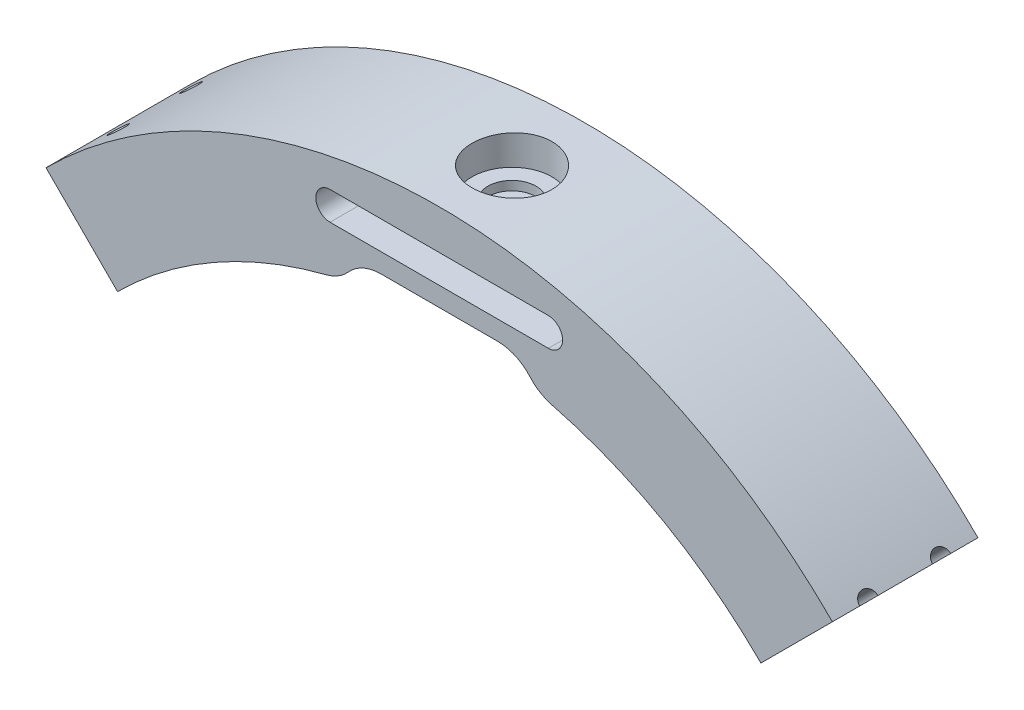
from build123d import *

# Parameters (mm, degrees)
SKETCH1_R                    = 76.4
BOSS_EXTRUDE1_DEPTH          = 20
CUT_EXTRUDE1_REACH           = 111.881
SKETCH2_R                    = 62.5
CUT_EXTRUDE2_DEPTH           = 110.881390599
CIRPATTERN1_COUNT            = 4
R_P_TITION_CIRCULAIRE2_COUNT = 4
CUT_EXTRUDE4_START           = -20
CUT_EXTRUDE4_DEPTH           = 130.881390756
CIRPATTERN8_COUNT            = 4
CIRPATTERN8_START            = -20
CIRPATTERN8_COPY_1_DEPTH     = 130.881390756
CIRPATTERN8_COPY_2_DEPTH     = 130.881390756
CIRPATTERN8_COPY_3_DEPTH     = 130.881390756
SPLIT1_SURFACE_1_BACK        = 218.015
SPLIT1_SURFACE_1_DEPTH       = 436.03


# Read off the part's stored shape, not the designer's step: Répétition circulaire1, Répétition linéaire1
with BuildPart() as part:
    # Sketch1 → Boss-Extrude1 (new body)
    with BuildSketch(Plane.XY):
        Circle(SKETCH1_R)
    extrude(amount=BOSS_EXTRUDE1_DEPTH)

    # Sketch2 → Cut-Extrude1 (cut, up to next)
    with BuildSketch(Plane.XY.offset(20), mode=Mode.PRIVATE) as cut_extrude1_sk1:
        Circle(SKETCH2_R)
    cut_extrude1_tool1 = extrude(cut_extrude1_sk1.sketch, amount=-CUT_EXTRUDE1_REACH, mode=Mode.PRIVATE) & part.part
    add(cut_extrude1_tool1.solids().sort_by_distance((0, 0, 20))[0], mode=Mode.SUBTRACT)

    # Sketch39 → Cut-Extrude2 (cut, through all)
    with BuildSketch(Plane(origin=(0, 0, 0), x_dir=(-1, 0, 0), z_dir=(0, 0, -1))):
        with BuildLine():
            Line((-15, 70.95), (15, 70.95))
            ThreePointArc((15, 70.95), (16.95, 69), (15, 67.05))
            Line((15, 67.05), (-15, 67.05))
            ThreePointArc((-15, 67.05), (-16.95, 69), (-15, 70.95))
        make_face()
    cut_extrude2 = extrude(amount=-CUT_EXTRUDE2_DEPTH, mode=Mode.SUBTRACT)

    # CirPattern1: Cut-Extrude2 ×4 about axis
    cirpattern1_axis = Axis((0, 0, 0), (0, 0, 1))
    for i in range(1, CIRPATTERN1_COUNT):
        add(cut_extrude2.rotate(cirpattern1_axis, i * 360 / CIRPATTERN1_COUNT), mode=Mode.SUBTRACT)

    # Esquisse2 → M3 Tapped Hole1 (revolve, cut)
    with BuildSketch(Plane(origin=(49.10897338, -58.525795454, 5), x_dir=(0.766044443118979, 0.6427876096865381, 0), z_dir=(0, 0, 1))):
        Polygon((0, 0), (0, 8.751075774), (1.25, 8), (1.25, 0), align=None)
    revolve(axis=Axis((53.190674702, -63.390177668, 5), (-0.6427876096865383, 0.766044443118979, 0)), mode=Mode.SUBTRACT)

    # Esquisse2 at point 2 (carried to point 2, square into its face) → M3 Tapped Hole1 at 2 (revolve, cut)
    with BuildSketch(Plane(origin=(-54.022958083, -54.022958083, 5), x_dir=(0.707106781, -0.707106781, 0), z_dir=(0, 0, 1))):
        Polygon((0, 0), (0, 8.751075774), (1.25, 8), (1.25, 0), align=None)
    revolve(axis=Axis((-58.513086143, -58.513086143, 5), (0.707106781, 0.707106781, 0)), mode=Mode.SUBTRACT)

    # Esquisse2 at point 3 (carried to point 3, square into its face) → M3 Tapped Hole1 at 3 (revolve, cut)
    with BuildSketch(Plane(origin=(-58.525795454, 49.10897338, 5), x_dir=(-0.642788057, -0.766044068, 0), z_dir=(0, 0, 1))):
        Polygon((0, 0), (0, 8.751075774), (1.25, 8), (1.25, 0), align=None)
    revolve(axis=Axis((-63.390175285, 53.190677542, 5), (0.766044068, -0.642788057, 0)), mode=Mode.SUBTRACT)

    # Répétition circulaire1 outline → Répétition circulaire1 (revolve, cut)
    with BuildSketch(Plane(origin=(0, 0, 5), x_dir=(0.6427876096865408, 0.7660444431189769, 0), z_dir=(0, 0, -1))):
        Polygon((0, 67.648924226), (1.25, 68.4), (1.25, 76.400001412), (0, 76.400001412), align=None)
    revolve(axis=Axis((0, 0, 5), (0.7660444431189771, -0.6427876096865409, 0)), mode=Mode.SUBTRACT)

    # R_p_tition circulaire1 2 outline → R_p_tition circulaire1 2 (revolve, cut)
    with BuildSketch(Plane(origin=(0, 0, 5), x_dir=(0.707106781186546, -0.707106781186549, 0), z_dir=(0, 0, 1))):
        Polygon((0, 67.648924226), (1.25, 68.4), (1.25, 76.400001412), (0, 76.400001412), align=None)
    revolve(axis=Axis((0, 0, 5), (0.707106781186549, 0.707106781186546, 0)), mode=Mode.SUBTRACT)

    # R_p_tition circulaire1 3 outline → R_p_tition circulaire1 3 (revolve, cut)
    with BuildSketch(Plane(origin=(0, 0, 5), x_dir=(0.7660444431189789, 0.6427876096865381, 0), z_dir=(0, 0, -1))):
        Polygon((1.25, -76.400001412), (1.25, -68.4), (0, -67.648924226), (0, -76.400001412), align=None)
    revolve(axis=Axis((0, 0, 5), (0.6427876096865381, -0.7660444431189789, 0)), mode=Mode.SUBTRACT)

    # Répétition linéaire1 outline → Répétition linéaire1 (revolve, cut)
    with BuildSketch(Plane(origin=(0, 0, 15), x_dir=(0.6427876096865408, 0.7660444431189769, 0), z_dir=(0, 0, -1))):
        Polygon((1.25, -76.400001412), (1.25, -68.4), (0, -67.648924226), (0, -76.400001412), align=None)
        Polygon((0, 76.400001412), (0, 67.648924226), (1.25, 68.4), (1.25, 76.400001412), align=None)
    revolve(axis=Axis((0, 0, 15), (0.7660444431189771, -0.6427876096865409, 0)), mode=Mode.SUBTRACT)

    # R_p_tition lin_aire1 2 outline → R_p_tition lin_aire1 2 (revolve, cut)
    with BuildSketch(Plane(origin=(0, 0, 15), x_dir=(0.707106781186546, -0.707106781186549, 0), z_dir=(0, 0, 1))):
        Polygon((1.25, -76.400001412), (1.25, -68.4), (0, -67.648924226), (0, -76.400001412), align=None)
        Polygon((0, 76.400001412), (0, 67.648924226), (1.25, 68.4), (1.25, 76.400001412), align=None)
    revolve(axis=Axis((0, 0, 15), (0.707106781186549, 0.707106781186546, 0)), mode=Mode.SUBTRACT)

    # R_p_tition lin_aire1 3 outline → R_p_tition lin_aire1 3 (revolve, cut)
    with BuildSketch(Plane(origin=(0, 0, 15), x_dir=(0.7660444431189789, 0.6427876096865381, 0), z_dir=(0, 0, -1))):
        Polygon((0, 67.648924226), (1.25, 68.4), (1.25, 76.400001412), (0, 76.400001412), align=None)
        Polygon((1.25, -68.4), (0, -67.648924226), (0, -76.400001412), (1.25, -76.400001412), align=None)
    revolve(axis=Axis((0, 0, 15), (0.6427876096865381, -0.7660444431189789, 0)), mode=Mode.SUBTRACT)

    # Esquisse4 → CBORE for M6 Hex Socket Head Cap Screw1 (revolve, cut)
    with BuildSketch(Plane(origin=(0, 76.4, 10), x_dir=(0, 0, 1), z_dir=(1, 0, 0))):
        Polygon((0, 0), (0, 30.482840043), (3.3, 28.5), (3.3, 4.2), (5.5, 4.2), (5.5, 0), align=None)
    cbore_for_m6_hex_socket_head_cap_screw1 = revolve(axis=Axis((0, 82.75, 10), (0, -1, 0)), mode=Mode.SUBTRACT)

    # Répétition circulaire2: CBORE for M6 Hex Socket Head Cap Screw1 ×4 about axis
    r_p_tition_circulaire2_axis = Axis((0, 0, 0), (0, 0, 1))
    for i in range(1, R_P_TITION_CIRCULAIRE2_COUNT):
        add(cbore_for_m6_hex_socket_head_cap_screw1.rotate(r_p_tition_circulaire2_axis, i * 360 / R_P_TITION_CIRCULAIRE2_COUNT), mode=Mode.SUBTRACT)

    # Sketch47 → Cut-Extrude4 (cut)
    with BuildSketch(Plane(origin=(0, 0, 0), x_dir=(-1, 0, 0), z_dir=(0, 0, -1)).offset(CUT_EXTRUDE4_START)):
        with BuildLine():
            Line((8, 64.4), (0, 64.4))
            Line((0, 64.4), (0, 62.5))
            ThreePointArc((0, 62.5), (7.806310396, 62.010575856), (15.490361696, 60.549968576))
            ThreePointArc((15.490361696, 60.549968576), (13.852369253, 61.240856226), (12.488718209, 62.38138278))
            ThreePointArc((12.488718209, 62.38138278), (10.460864007, 63.872124664), (8, 64.4))
        make_face()
    cut_extrude4 = extrude(amount=CUT_EXTRUDE4_DEPTH, mode=Mode.SUBTRACT)

    # Mirror1: Cut-Extrude4 across plane
    add(cut_extrude4.mirror(Plane.ZY), mode=Mode.SUBTRACT)

    # CirPattern8: Cut-Extrude4 ×4 about axis
    cirpattern8_axis = Axis((0, 0, 0), (0, 0, 1))
    for i in range(1, CIRPATTERN8_COUNT):
        add(cut_extrude4.rotate(cirpattern8_axis, i * 360 / CIRPATTERN8_COUNT), mode=Mode.SUBTRACT)

    # CirPattern8 copy 1 sketch → CirPattern8 copy 1 (cut)
    with BuildSketch(Plane.YX.offset(CIRPATTERN8_START)):
        with BuildLine():
            Line((8, -64.4), (0, -64.4))
            Line((0, -64.4), (0, -62.5))
            ThreePointArc((0, -62.5), (7.806310396, -62.010575856), (15.490361696, -60.549968576))
            ThreePointArc((15.490361696, -60.549968576), (13.852369253, -61.240856226), (12.488718209, -62.38138278))
            ThreePointArc((12.488718209, -62.38138278), (10.460864007, -63.872124664), (8, -64.4))
        make_face()
    extrude(amount=CIRPATTERN8_COPY_1_DEPTH, mode=Mode.SUBTRACT)

    # CirPattern8 copy 2 sketch → CirPattern8 copy 2 (cut)
    with BuildSketch(Plane(origin=(0, 0, 0), x_dir=(-1, 0, 0), z_dir=(0, 0, -1)).offset(CIRPATTERN8_START)):
        with BuildLine():
            Line((8, -64.4), (0, -64.4))
            Line((0, -64.4), (0, -62.5))
            ThreePointArc((0, -62.5), (7.806310396, -62.010575856), (15.490361696, -60.549968576))
            ThreePointArc((15.490361696, -60.549968576), (13.852369253, -61.240856226), (12.488718209, -62.38138278))
            ThreePointArc((12.488718209, -62.38138278), (10.460864007, -63.872124664), (8, -64.4))
        make_face()
    extrude(amount=CIRPATTERN8_COPY_2_DEPTH, mode=Mode.SUBTRACT)

    # CirPattern8 copy 3 sketch → CirPattern8 copy 3 (cut)
    with BuildSketch(Plane(origin=(0, 0, 0), x_dir=(0, -1, 0), z_dir=(0, 0, -1)).offset(CIRPATTERN8_START)):
        with BuildLine():
            Line((8, -64.4), (0, -64.4))
            Line((0, -64.4), (0, -62.5))
            ThreePointArc((0, -62.5), (7.806310396, -62.010575856), (15.490361696, -60.549968576))
            ThreePointArc((15.490361696, -60.549968576), (13.852369253, -61.240856226), (12.488718209, -62.38138278))
            ThreePointArc((12.488718209, -62.38138278), (10.460864007, -63.872124664), (8, -64.4))
        make_face()
    extrude(amount=CIRPATTERN8_COPY_3_DEPTH, mode=Mode.SUBTRACT)

    # Split1: cut with a surface, the side behind it stays
    # Split1 surface: a surface, the sketch's curves swept straight by 436.03 mm
    with BuildLine(Plane(origin=(0, 0, 0), x_dir=(-1, 0, 0), z_dir=(0, 0, -1)).offset(-SPLIT1_SURFACE_1_BACK), mode=Mode.PRIVATE) as split1_surface_1_path:
        Line((73.828428705, 73.828428705), (0, 0))
        Line((0, 0), (-82.641961486, 82.641961486))
    split1_surface_1 = Shell.extrude(split1_surface_1_path.wire(), (0 * SPLIT1_SURFACE_1_DEPTH, 0 * SPLIT1_SURFACE_1_DEPTH, -1 * SPLIT1_SURFACE_1_DEPTH))
    split(bisect_by=split1_surface_1, keep=Keep.BOTTOM)


solid = part.part
